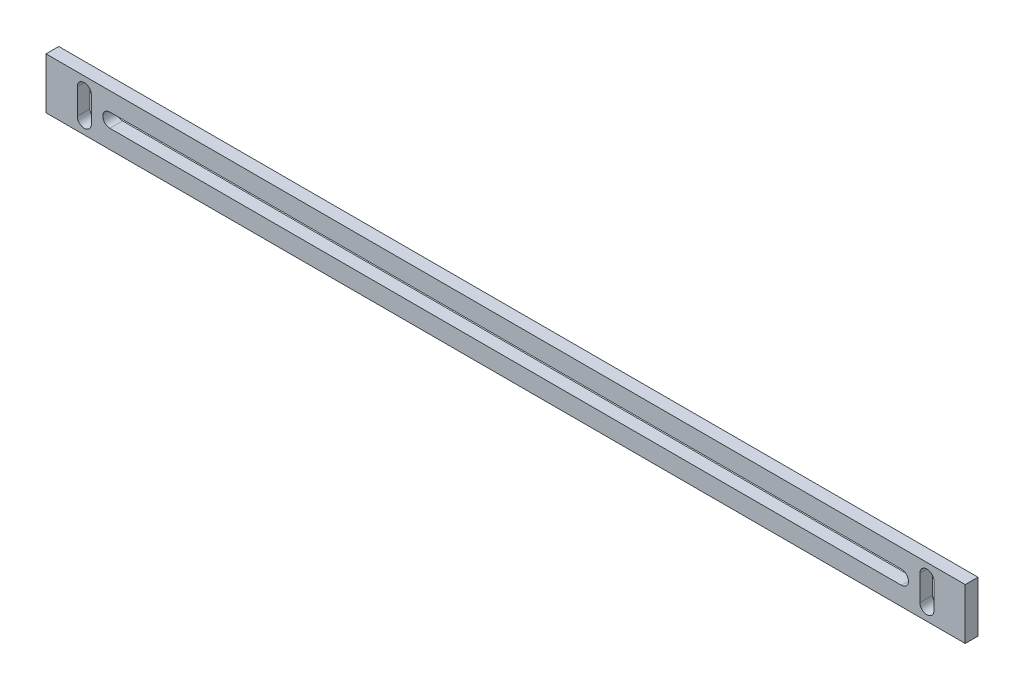
from build123d import *

# Parameters (mm, degrees)
EXTRUDE_1_DEPTH     = 5
CUT_EXTRUDE_1_DEPTH = 5
SKETCH_4_W          = 5
SKETCH_4_H          = 20
EXTRUDE_2_DEPTH     = 5


with BuildPart() as part:
    # 草图1 → 凸台-拉伸1 (new body)
    with BuildSketch(Plane.XY):
        Polygon((175, 10), (0, 10), (-175, 10), (-175, -10), (175, -10), align=None)
    extrude(amount=EXTRUDE_1_DEPTH)

    # 草图3 → 切除-拉伸1 (cut)
    with BuildSketch(Plane(origin=(0, 0, 0), x_dir=(-1, 0, 0), z_dir=(0, 0, -1))):
        with BuildLine():
            Line((-167.75, 5), (-167.75, -5))
            ThreePointArc((-167.75, -5), (-165, -7.75), (-162.25, -5))
            Line((-162.25, -5), (-162.25, 5))
            ThreePointArc((-162.25, 5), (-165, 7.75), (-167.75, 5))
        make_face()
        with BuildLine():
            Line((162.25, 5), (162.25, -5))
            ThreePointArc((162.25, -5), (165, -7.75), (167.75, -5))
            Line((167.75, -5), (167.75, 5))
            ThreePointArc((167.75, 5), (165, 7.75), (162.25, 5))
        make_face()
        with BuildLine():
            ThreePointArc((-155, 2.75), (-157.75, 0), (-155, -2.75))
            Line((-155, -2.75), (155, -2.75))
            ThreePointArc((155, -2.75), (157.75, 0), (155, 2.75))
            Line((155, 2.75), (-155, 2.75))
        make_face()
    extrude(amount=-CUT_EXTRUDE_1_DEPTH, mode=Mode.SUBTRACT)

    # 草图4 → 凸台-拉伸2 (add)
    with BuildSketch(Plane(origin=(0, 0, 0), x_dir=(-1, 0, 0), z_dir=(0, 0, -1))):
        with Locations((-177.5, 0)):
            Rectangle(SKETCH_4_W, SKETCH_4_H)
        with Locations((177.5, 0)):
            Rectangle(SKETCH_4_W, SKETCH_4_H)
    extrude(amount=-EXTRUDE_2_DEPTH)


solid = part.part
